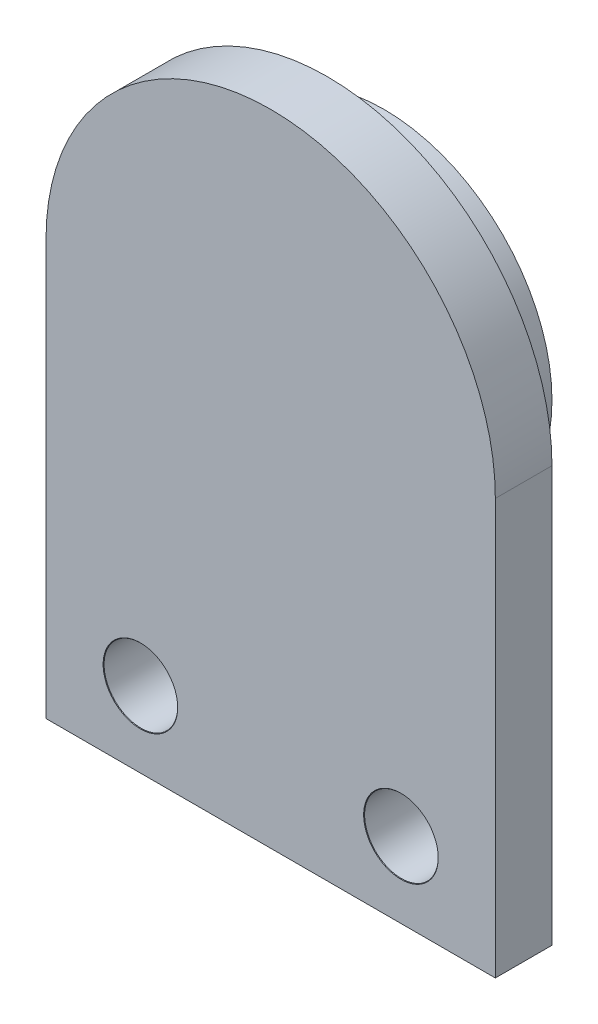
from build123d import *

# Parameters (mm, degrees)
BOSS_EXTRUDE1_DEPTH              = 3
SKETCH2_R                        = 8.9
BOSS_EXTRUDE2_DEPTH              = 3
SKETCH3_R                        = 2
BOSS_EXTRUDE3_DEPTH              = 3
M3_5_CLEARANCE_HOLE1_D           = 3.9
M3_5_CLEARANCE_HOLE1_CSINK_D     = 3.95
M3_5_CLEARANCE_HOLE1_CSINK_ANGLE = 90


with BuildPart() as part:
    # Sketch1 → Boss-Extrude1 (new body)
    with BuildSketch(Plane.XY):
        with BuildLine():
            Line((-11.9, 0), (-11.9, -22))
            Line((-11.9, -22), (11.9, -22))
            Line((11.9, -22), (11.9, 0))
            ThreePointArc((11.9, 0), (0, 11.9), (-11.9, 0))
        make_face()
    extrude(amount=BOSS_EXTRUDE1_DEPTH)

    # Sketch2 → Boss-Extrude2 (add)
    with BuildSketch(Plane(origin=(0, 0, 0), x_dir=(-1, 0, 0), z_dir=(0, 0, -1))):
        Circle(SKETCH2_R)
    extrude(amount=BOSS_EXTRUDE2_DEPTH)

    # Sketch3 → Boss-Extrude3 (add)
    with BuildSketch(Plane(origin=(0, 0, -3), x_dir=(-1, 0, 0), z_dir=(0, 0, -1))):
        Circle(SKETCH3_R)
    extrude(amount=BOSS_EXTRUDE3_DEPTH)

    # M3.5 Clearance Hole1 (through all)
    with Locations(Plane(origin=(-6.9, -18, 3), x_dir=(1, 0, 0), z_dir=(0, 0, 1))):
        with Locations((0, 0), (13.8, 0)):
            CounterSinkHole(M3_5_CLEARANCE_HOLE1_D / 2, M3_5_CLEARANCE_HOLE1_CSINK_D / 2, counter_sink_angle=M3_5_CLEARANCE_HOLE1_CSINK_ANGLE)


solid = part.part
